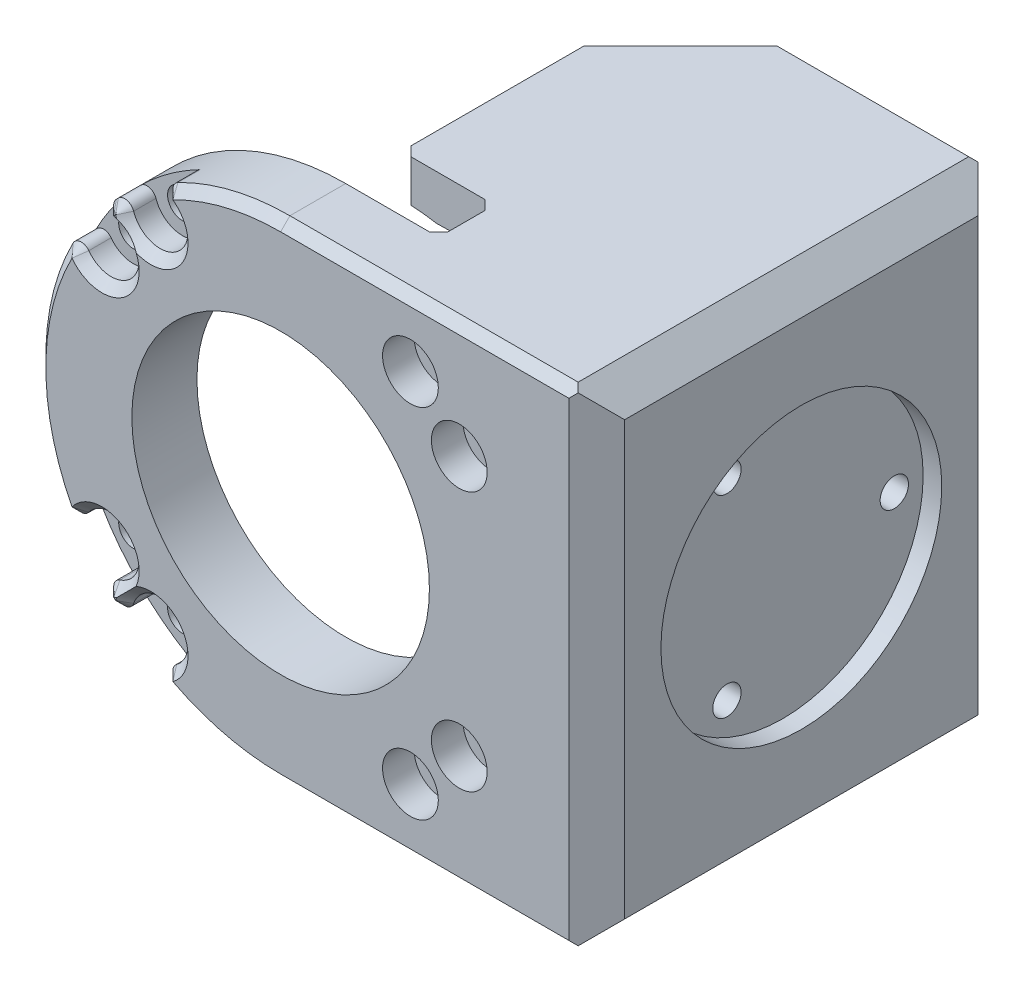
from build123d import *

# Parameters (mm, degrees)
SKETCH_1_R                   = 16
EXTRUDE_1_DEPTH              = 7
SKETCH_2_W                   = 44
SKETCH_2_H                   = 52.5
EXTRUDE_2_DEPTH              = 4
CHAMFER_1_SIZE               = 3
EXTRUDE_START                = 37
EXTRUDE_5_DEPTH              = 37
CHAMFER_7_SIZE               = 10
CHAMFER_8_SIZE               = 3
CHAMFER_9_SIZE               = 1
HOLE_WIZARD_M3_1_D           = 3.2
HOLE_WIZARD_M3_1_CBORE_D     = 6
HOLE_WIZARD_M3_1_CBORE_DEPTH = 3.4
FILLET_11_R                  = 1
SKETCH_24_W                  = 6
SKETCH_24_H                  = 52.5
CUT_EXTRUDE_3_DEPTH          = 10
CHAMFER_12_SIZE              = 1
SKETCH_6_R                   = 1.525
CUT_EXTRUDE_4_DEPTH          = 89.06425224
SKETCH_25_R                  = 15.1
CUT_EXTRUDE_5_DEPTH          = 2


with BuildPart() as part:
    # 草图1 → 凸台-拉伸1 (new body)
    with BuildSketch(Plane.XY):
        with BuildLine():
            Line((0, 0), (30, 0))
            Line((30, 0), (30, 52.5))
            Line((30, 52.5), (0, 52.5))
            ThreePointArc((0, 52.5), (-26.25, 26.25), (0, 0))
        make_face()
        with Locations((0, 26.25)):
            Circle(SKETCH_1_R, mode=Mode.SUBTRACT)
    extrude(amount=EXTRUDE_1_DEPTH)

    # 草图2 → 凸台-拉伸2 (add)
    with BuildSketch(Plane(origin=(30, 0, 0), x_dir=(0, 0, -1), z_dir=(1, 0, 0))):
        with Locations((15, 26.25)):
            Rectangle(SKETCH_2_W, SKETCH_2_H)
    extrude(amount=EXTRUDE_2_DEPTH)

    # 倒角1
    chamfer_1_edges = [part.edges().sort_by_distance(p)[0] for p in [
        (34, 26.25, 7),
        (34, 26.25, -37),
    ]]
    chamfer(chamfer_1_edges, length=CHAMFER_1_SIZE)

    # 草图16 → 凸台-拉伸5 (add)
    with BuildSketch(Plane(origin=(0, 0, 0), x_dir=(-1, 0, 0), z_dir=(0, 0, -1)).offset(EXTRUDE_START)):
        with BuildLine():
            Line((-30, 52.5), (0, 52.5))
            Line((0, 52.5), (0, 48))
            ThreePointArc((0, 48), (-1.895637405, 47.917234683), (-3.776847864, 47.669568628))
            Line((-3.776847864, 47.669568628), (-13.289901618, 47.872701418))
            ThreePointArc((-13.289901618, 47.872701418), (-14.403787228, 47.924430816), (-15.429362873, 47.486696102))
            ThreePointArc((-15.429362873, 47.486696102), (-18.561553006, 44.811553006), (-21.236696102, 41.679362873))
            ThreePointArc((-21.236696102, 41.679362873), (-21.645078417, 40.793513152), (-21.683374468, 39.818813579))
            Line((-21.683374468, 39.818813579), (-21.419568628, 30.026847864))
            ThreePointArc((-21.419568628, 30.026847864), (-21.75, 26.25), (-21.419568628, 22.473152136))
            Line((-21.419568628, 22.473152136), (-21.622701418, 12.960098382))
            ThreePointArc((-21.622701418, 12.960098382), (-21.674430816, 11.846212772), (-21.236696102, 10.820637127))
            ThreePointArc((-21.236696102, 10.820637127), (-18.561553006, 7.688446994), (-15.429362873, 5.013303898))
            ThreePointArc((-15.429362873, 5.013303898), (-14.543513152, 4.604921583), (-13.568813579, 4.566625532))
            Line((-13.568813579, 4.566625532), (-3.776847864, 4.830431372))
            ThreePointArc((-3.776847864, 4.830431372), (-1.895637405, 4.582765317), (0, 4.5))
            Line((0, 4.5), (0, 0))
            Line((0, 0), (-30, 0))
            Line((-30, 0), (-30, 52.5))
        make_face()
    extrude(amount=-EXTRUDE_5_DEPTH)

    # 倒角7
    chamfer_7_edges = [part.edges().sort_by_distance(p)[0] for p in [
        (0, 2.25, -37),
        (0, 50.25, -37),
    ]]
    chamfer(chamfer_7_edges, length=CHAMFER_7_SIZE)

    # 倒角8
    chamfer_8_edges = [part.edges().sort_by_distance(p)[0] for p in [
        (34, 0, -15),
        (34, 52.5, -15),
    ]]
    chamfer(chamfer_8_edges, length=CHAMFER_8_SIZE)

    # 倒角9
    chamfer_9_edges = [part.edges().sort_by_distance(p)[0] for p in [
        (0, 0, -13.5),
        (5, 0, -32),
        (5, 52.5, -32),
        (20.5, 52.5, -37),
        (20.5, 0, -37),
    ]]
    chamfer(chamfer_9_edges, length=CHAMFER_9_SIZE)

    # M3 六角圆柱头螺钉的柱形沉头孔1 (through all)
    with Locations(Plane.XY.offset(7)):
        with Locations((19.214153616, 12.290100258), (-19.214153616, 12.290100258), (-13.959899742, 7.035846384), (-13.959899742, 45.464153616), (-19.214153616, 40.209899742), (19.214153616, 40.209899742), (13.959899742, 45.464153616), (13.959899742, 7.035846384)):
            CounterBoreHole(HOLE_WIZARD_M3_1_D / 2, HOLE_WIZARD_M3_1_CBORE_D / 2, HOLE_WIZARD_M3_1_CBORE_DEPTH)

    # 圆角11
    fillet_11_edges = [part.edges().sort_by_distance(p)[0] for p in [
        (-22.214042982, 40.235663888, 5.3),
        (-20.16567357, 43.055002513, 5.3),
        (-16.805002513, 46.41567357, 5.3),
        (-13.985663888, 48.464042982, 5.3),
        (-13.985663888, 4.035957018, 5.3),
        (-16.805002513, 6.08432643, 5.3),
        (-20.16567357, 9.444997487, 5.3),
        (-22.214042982, 12.264336112, 5.3),
    ]]
    fillet(fillet_11_edges, radius=FILLET_11_R)

    # 倒角11
    # the kernel refuses this chamfer: 1 mm, written as the material it takes off along each edge
    with BuildSketch(Plane(origin=(0, 26.25, 7), x_dir=(0, 1, 0), z_dir=(1, 0, 0))) as chamfer_11_piece_1:
        with BuildLine():
            Line((25.221715729, 0.028284271), (26.278284271, -1.028284271))
            Line((26.278284271, -1.028284271), (26.298284271, -1.028284271))
            ThreePointArc((26.298284271, -1.028284271), (26.27, -0.514142136), (26.27, 0))
            Line((26.27, 0), (26.25, 0.02))
            ThreePointArc((26.25, 0.02), (25.735857864, 0.02), (25.221715729, 0.048284271))
            Line((25.221715729, 0.048284271), (25.221715729, 0.028284271))
        make_face()
    revolve(axis=Axis((0, 26.25, 7), (0, 0, 1)), revolution_arc=27.315851026, mode=Mode.SUBTRACT)
    with BuildSketch(Plane(origin=(33.571682988, 0, 7), x_dir=(0, 1, 0), z_dir=(-1, 0, 0))) as chamfer_11_piece_2:
        with BuildLine():
            Line((1.028284271, -0.028284271), (-0.028284271, 1.028284271))
            Line((-0.028284271, 1.028284271), (-0.048284271, 1.028284271))
            ThreePointArc((-0.048284271, 1.028284271), (-0.02, 0.514142136), (-0.02, 0))
            Line((-0.02, 0), (0, -0.02))
            ThreePointArc((0, -0.02), (0.514142136, -0.02), (1.028284271, -0.048284271))
            Line((1.028284271, -0.048284271), (1.028284271, -0.028284271))
        make_face()
    extrude(amount=33.571682988, mode=Mode.SUBTRACT)
    with BuildSketch(Plane(origin=(0, 26.25, 7), x_dir=(-0.8884903120653775, 0.45889537518476686, 0), z_dir=(0.45889537518476686, 0.8884903120653775, 0))) as chamfer_11_piece_3:
        with BuildLine():
            Line((25.221715729, 0.028284271), (26.278284271, -1.028284271))
            Line((26.278284271, -1.028284271), (26.298284271, -1.028284271))
            ThreePointArc((26.298284271, -1.028284271), (26.27, -0.514142136), (26.27, 0))
            Line((26.27, 0), (26.25, 0.02))
            ThreePointArc((26.25, 0.02), (25.735857864, 0.02), (25.221715729, 0.048284271))
            Line((25.221715729, 0.048284271), (25.221715729, 0.028284271))
        make_face()
    revolve(axis=Axis((0, 26.25, 7), (0, 0, 1)), revolution_arc=54.631702051, mode=Mode.SUBTRACT)
    with BuildSketch(Plane(origin=(0, 26.25, 7), x_dir=(-0.7031980313995887, 0.7109940426162115, 0), z_dir=(0.7109940426162115, 0.7031980313995887, 0))) as chamfer_11_piece_4:
        with BuildLine():
            Line((25.221715729, 0.028284271), (26.278284271, -1.028284271))
            Line((26.278284271, -1.028284271), (26.298284271, -1.028284271))
            ThreePointArc((26.298284271, -1.028284271), (26.27, -0.514142136), (26.27, 0))
            Line((26.27, 0), (26.25, 0.02))
            ThreePointArc((26.25, 0.02), (25.735857864, 0.02), (25.221715729, 0.048284271))
            Line((25.221715729, 0.048284271), (25.221715729, 0.028284271))
        make_face()
    revolve(axis=Axis((0, 26.25, 7), (0, 0, 1)), revolution_arc=0.631702048, mode=Mode.SUBTRACT)
    with BuildSketch(Plane(origin=(0, 26.25, 7), x_dir=(-0.4588953751847669, -0.8884903120653774, 0), z_dir=(-0.8884903120653774, 0.4588953751847669, 0))) as chamfer_11_piece_5:
        with BuildLine():
            Line((25.221715729, 0.028284271), (26.278284271, -1.028284271))
            Line((26.278284271, -1.028284271), (26.298284271, -1.028284271))
            ThreePointArc((26.298284271, -1.028284271), (26.27, -0.514142136), (26.27, 0))
            Line((26.27, 0), (26.25, 0.02))
            ThreePointArc((26.25, 0.02), (25.735857864, 0.02), (25.221715729, 0.048284271))
            Line((25.221715729, 0.048284271), (25.221715729, 0.028284271))
        make_face()
    revolve(axis=Axis((0, 26.25, 7), (0, 0, 1)), revolution_arc=27.315851026, mode=Mode.SUBTRACT)
    with BuildSketch(Plane(origin=(0, 26.25, 7), x_dir=(-0.7109940426162115, -0.7031980313995887, 0), z_dir=(-0.7031980313995887, 0.7109940426162115, 0))) as chamfer_11_piece_6:
        with BuildLine():
            Line((25.221715729, 0.028284271), (26.278284271, -1.028284271))
            Line((26.278284271, -1.028284271), (26.298284271, -1.028284271))
            ThreePointArc((26.298284271, -1.028284271), (26.27, -0.514142136), (26.27, 0))
            Line((26.27, 0), (26.25, 0.02))
            ThreePointArc((26.25, 0.02), (25.735857864, 0.02), (25.221715729, 0.048284271))
            Line((25.221715729, 0.048284271), (25.221715729, 0.028284271))
        make_face()
    revolve(axis=Axis((0, 26.25, 7), (0, 0, 1)), revolution_arc=0.631702048, mode=Mode.SUBTRACT)
    with BuildSketch(Plane(origin=(-13.959899742, 7.035846384, 7), x_dir=(-0.9489626377099037, 0.3153885099851645, 0), z_dir=(-0.3153885099851645, -0.9489626377099037, 0))) as chamfer_11_piece_7:
        with BuildLine():
            Line((4.028284271, -0.028284271), (2.971715729, 1.028284271))
            Line((2.971715729, 1.028284271), (2.951715729, 1.028284271))
            ThreePointArc((2.951715729, 1.028284271), (2.98, 0.514142136), (2.98, 0))
            Line((2.98, 0), (3, -0.02))
            ThreePointArc((3, -0.02), (3.514142136, -0.02), (4.028284271, -0.048284271))
            Line((4.028284271, -0.048284271), (4.028284271, -0.028284271))
        make_face()
    revolve(axis=Axis((-13.959899742, 7.035846384, 7), (0, 0, -1)), revolution_arc=215.231461254, mode=Mode.SUBTRACT)
    with BuildSketch(Plane(origin=(-19.214153616, 12.290100258, 7), x_dir=(-0.8050566909126954, 0.5931978796461606, 0), z_dir=(-0.5931978796461606, -0.8050566909126954, 0))) as chamfer_11_piece_8:
        with BuildLine():
            Line((4.028284271, -0.028284271), (2.971715729, 1.028284271))
            Line((2.971715729, 1.028284271), (2.951715729, 1.028284271))
            ThreePointArc((2.951715729, 1.028284271), (2.98, 0.514142136), (2.98, 0))
            Line((2.98, 0), (3, -0.02))
            ThreePointArc((3, -0.02), (3.514142136, -0.02), (4.028284271, -0.048284271))
            Line((4.028284271, -0.048284271), (4.028284271, -0.028284271))
        make_face()
    revolve(axis=Axis((-19.214153616, 12.290100258, 7), (0, 0, -1)), revolution_arc=215.231461254, mode=Mode.SUBTRACT)
    with BuildSketch(Plane(origin=(-13.959899742, 45.464153616, 7), x_dir=(0.5931978796461579, 0.8050566909126975, 0), z_dir=(-0.8050566909126975, 0.5931978796461579, 0))) as chamfer_11_piece_9:
        with BuildLine():
            Line((4.028284271, -0.028284271), (2.971715729, 1.028284271))
            Line((2.971715729, 1.028284271), (2.951715729, 1.028284271))
            ThreePointArc((2.951715729, 1.028284271), (2.98, 0.514142136), (2.98, 0))
            Line((2.98, 0), (3, -0.02))
            ThreePointArc((3, -0.02), (3.514142136, -0.02), (4.028284271, -0.048284271))
            Line((4.028284271, -0.048284271), (4.028284271, -0.028284271))
        make_face()
    revolve(axis=Axis((-13.959899742, 45.464153616, 7), (0, 0, -1)), revolution_arc=215.231461254, mode=Mode.SUBTRACT)
    with BuildSketch(Plane(origin=(-19.214153616, 40.209899742, 7), x_dir=(0.3153885099851653, 0.9489626377099033, 0), z_dir=(-0.9489626377099033, 0.3153885099851653, 0))) as chamfer_11_piece_10:
        with BuildLine():
            Line((4.028284271, -0.028284271), (2.971715729, 1.028284271))
            Line((2.971715729, 1.028284271), (2.951715729, 1.028284271))
            ThreePointArc((2.951715729, 1.028284271), (2.98, 0.514142136), (2.98, 0))
            Line((2.98, 0), (3, -0.02))
            ThreePointArc((3, -0.02), (3.514142136, -0.02), (4.028284271, -0.048284271))
            Line((4.028284271, -0.048284271), (4.028284271, -0.028284271))
        make_face()
    revolve(axis=Axis((-19.214153616, 40.209899742, 7), (0, 0, -1)), revolution_arc=215.231461254, mode=Mode.SUBTRACT)
    with BuildSketch(Plane(origin=(-11.587108278, 48.684380365, 7), x_dir=(-0.5931978511211996, -0.8050567119310237, 0), z_dir=(0.8050567119310237, -0.5931978511211996, 0))) as chamfer_11_piece_11:
        with BuildLine():
            Line((0, 4.5e-08), (1.028284217, 1.028284271))
            Line((1.028284217, 1.028284271), (1.048284217, 1.028284271))
            ThreePointArc((1.048284217, 1.028284271), (1.019999946, 0.514142136), (1.019999955, 0))
            Line((1.019999955, 0), (0.999999955, -0.02))
            Line((0.999999955, -0.02), (0, -0.047506275))
            Line((0, -0.047506275), (0, 4.5e-08))
        make_face()
    revolve(axis=Axis((-11.587108278, 48.684380365, 7), (0, 0, -1)), revolution_arc=116.299884825, mode=Mode.SUBTRACT)
    with BuildSketch(Plane(origin=(-17.755750262, 44.202599624, 7), x_dir=(0.9489626488848115, 0.31538847636133094, 0), z_dir=(0.31538847636133094, -0.9489626488848115, 0))) as chamfer_11_piece_12:
        with BuildLine():
            Line((0, -4.5e-08), (1.028284217, -1.028284271))
            Line((1.028284217, -1.028284271), (1.048284217, -1.028284271))
            ThreePointArc((1.048284217, -1.028284271), (1.019999946, -0.514142136), (1.019999955, 0))
            Line((1.019999955, 0), (0.999999955, 0.02))
            Line((0.999999955, 0.02), (0, 0.047506275))
            Line((0, 0.047506275), (0, -4.5e-08))
        make_face()
    revolve(axis=Axis((-17.755750262, 44.202599624, 7), (0, 0, 1)), revolution_arc=116.299884825, mode=Mode.SUBTRACT)
    with BuildSketch(Plane(origin=(-17.952599624, 44.005750262, 7), x_dir=(-0.31538847636128087, -0.9489626488848283, 0), z_dir=(0.9489626488848283, -0.31538847636128087, 0))) as chamfer_11_piece_13:
        with BuildLine():
            Line((0, 4.5e-08), (1.028284217, 1.028284271))
            Line((1.028284217, 1.028284271), (1.048284217, 1.028284271))
            ThreePointArc((1.048284217, 1.028284271), (1.019999946, 0.514142136), (1.019999955, 0))
            Line((1.019999955, 0), (0.999999955, -0.02))
            Line((0.999999955, -0.02), (0, -0.047506275))
            Line((0, -0.047506275), (0, 4.5e-08))
        make_face()
    revolve(axis=Axis((-17.952599624, 44.005750262, 7), (0, 0, -1)), revolution_arc=116.299884825, mode=Mode.SUBTRACT)
    with BuildSketch(Plane(origin=(-22.434380365, 37.837108278, 7), x_dir=(0.805056711931028, 0.5931978511211936, 0), z_dir=(0.5931978511211936, -0.805056711931028, 0))) as chamfer_11_piece_14:
        with BuildLine():
            Line((0, -4.5e-08), (1.028284217, -1.028284271))
            Line((1.028284217, -1.028284271), (1.048284217, -1.028284271))
            ThreePointArc((1.048284217, -1.028284271), (1.019999946, -0.514142136), (1.019999955, 0))
            Line((1.019999955, 0), (0.999999955, 0.02))
            Line((0.999999955, 0.02), (0, 0.047506275))
            Line((0, 0.047506275), (0, -4.5e-08))
        make_face()
    revolve(axis=Axis((-22.434380365, 37.837108278, 7), (0, 0, 1)), revolution_arc=116.299884825, mode=Mode.SUBTRACT)
    with BuildSketch(Plane(origin=(-22.434380365, 14.662891722, 7), x_dir=(0.8050567119310229, -0.5931978511212006, 0), z_dir=(0.5931978511212006, 0.8050567119310229, 0))) as chamfer_11_piece_15:
        with BuildLine():
            Line((0, 4.5e-08), (1.028284217, 1.028284271))
            Line((1.028284217, 1.028284271), (1.048284217, 1.028284271))
            ThreePointArc((1.048284217, 1.028284271), (1.019999946, 0.514142136), (1.019999955, 0))
            Line((1.019999955, 0), (0.999999955, -0.02))
            Line((0.999999955, -0.02), (0, -0.047506275))
            Line((0, -0.047506275), (0, 4.5e-08))
        make_face()
    revolve(axis=Axis((-22.434380365, 14.662891722, 7), (0, 0, -1)), revolution_arc=116.299884825, mode=Mode.SUBTRACT)
    with BuildSketch(Plane(origin=(-17.952599624, 8.494249738, 7), x_dir=(-0.31538847636130274, 0.948962648884821, 0), z_dir=(0.948962648884821, 0.31538847636130274, 0))) as chamfer_11_piece_16:
        with BuildLine():
            Line((0, -4.5e-08), (1.028284217, -1.028284271))
            Line((1.028284217, -1.028284271), (1.048284217, -1.028284271))
            ThreePointArc((1.048284217, -1.028284271), (1.019999946, -0.514142136), (1.019999955, 0))
            Line((1.019999955, 0), (0.999999955, 0.02))
            Line((0.999999955, 0.02), (0, 0.047506275))
            Line((0, 0.047506275), (0, -4.5e-08))
        make_face()
    revolve(axis=Axis((-17.952599624, 8.494249738, 7), (0, 0, 1)), revolution_arc=116.299884825, mode=Mode.SUBTRACT)
    with BuildSketch(Plane(origin=(-17.755750318, 8.297400445, 7), x_dir=(0.9489626337973922, -0.31538852175739795, 0), z_dir=(0.31538852175739795, 0.9489626337973922, 0))) as chamfer_11_piece_17:
        with BuildLine():
            Line((0, -3e-08), (1.028284298, 1.028284271))
            Line((1.028284298, 1.028284271), (1.048284298, 1.028284271))
            ThreePointArc((1.048284298, 1.028284271), (1.020000027, 0.514142136), (1.02000003, 0))
            Line((1.02000003, 0), (1.00000003, -0.02))
            Line((1.00000003, -0.02), (0, -0.047506277))
            Line((0, -0.047506277), (0, -3e-08))
        make_face()
    revolve(axis=Axis((-17.755750318, 8.297400445, 7), (0, 0, -1)), revolution_arc=116.299877018, mode=Mode.SUBTRACT)
    with BuildSketch(Plane(origin=(-11.587108195, 3.815619603, 7), x_dir=(-0.5931978896331799, 0.8050566835538613, 0), z_dir=(0.8050566835538613, 0.5931978896331799, 0))) as chamfer_11_piece_18:
        with BuildLine():
            Line((0, 3e-08), (1.028284298, -1.028284271))
            Line((1.028284298, -1.028284271), (1.048284298, -1.028284271))
            ThreePointArc((1.048284298, -1.028284271), (1.020000027, -0.514142136), (1.02000003, 0))
            Line((1.02000003, 0), (1.00000003, 0.02))
            Line((1.00000003, 0.02), (0, 0.047506277))
            Line((0, 0.047506277), (0, 3e-08))
        make_face()
    revolve(axis=Axis((-11.587108195, 3.815619603, 7), (0, 0, 1)), revolution_arc=116.299877018, mode=Mode.SUBTRACT)
    with BuildSketch(Plane(origin=(33.571682988, 52.5, 7), x_dir=(0, -1, 0), z_dir=(-1, 0, 0))) as chamfer_11_piece_19:
        with BuildLine():
            Line((1.028284271, 0.028284271), (-0.028284271, -1.028284271))
            Line((-0.028284271, -1.028284271), (-0.048284271, -1.028284271))
            ThreePointArc((-0.048284271, -1.028284271), (-0.02, -0.514142136), (-0.02, 0))
            Line((-0.02, 0), (0, 0.02))
            ThreePointArc((0, 0.02), (0.514142136, 0.02), (1.028284271, 0.048284271))
            Line((1.028284271, 0.048284271), (1.028284271, 0.028284271))
        make_face()
    extrude(amount=33.571682988, mode=Mode.SUBTRACT)

    # 草图24 → 切除-拉伸3 (cut)
    with BuildSketch(Plane.ZY):
        with Locations((-3, 26.25)):
            Rectangle(SKETCH_24_W, SKETCH_24_H)
    extrude(amount=-CUT_EXTRUDE_3_DEPTH, mode=Mode.SUBTRACT)

    # 倒角12
    chamfer_12_edges = [part.edges().sort_by_distance(p)[0] for p in [
        (10, 2.331386559, 0),
        (10, 2.331386559, -6),
        (0, 2.75, -6),
        (0, 50.25, -6),
        (10, 50.151225979, -6),
        (10, 50.151225979, 0),
    ]]
    chamfer(chamfer_12_edges, length=CHAMFER_12_SIZE)

    # 草图6 → 切除-拉伸4 (cut, through all)
    with BuildSketch(Plane(origin=(34, 0, 0), x_dir=(0, 0, -1), z_dir=(1, 0, 0))):
        with Locations((27, 26.25)):
            Circle(SKETCH_6_R)
        with Locations((9, 15.857695155)):
            Circle(SKETCH_6_R)
        with Locations((9, 36.642304845)):
            Circle(SKETCH_6_R)
    extrude(amount=-CUT_EXTRUDE_4_DEPTH, mode=Mode.SUBTRACT)

    # 草图25 → 切除-拉伸5 (cut)
    with BuildSketch(Plane(origin=(34, 0, 0), x_dir=(0, 0, -1), z_dir=(1, 0, 0))):
        with Locations((15, 26.25)):
            Circle(SKETCH_25_R)
    extrude(amount=-CUT_EXTRUDE_5_DEPTH, mode=Mode.SUBTRACT)


solid = part.part
